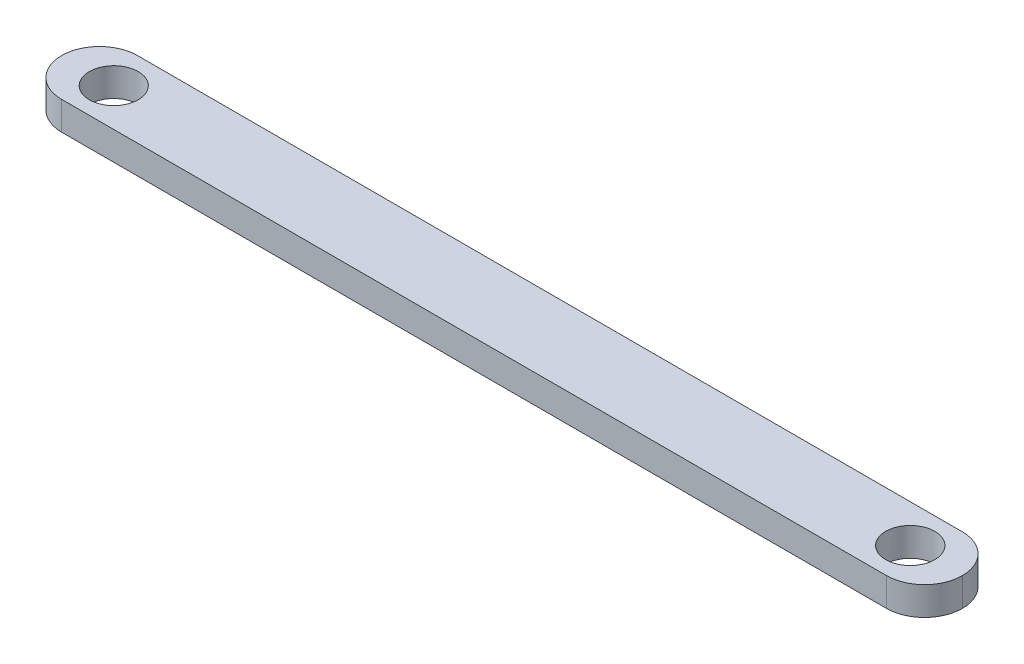
from build123d import *

# Parameters (mm, degrees)
SKETCH1_W           = 95
SKETCH1_H           = 8
SKETCH1_R           = 2.58
SKETCH1_R_2         = 2.59
BOSS_EXTRUDE1_DEPTH = 3
REDONDEO2_R         = 4


with BuildPart() as part:
    # Sketch1 → Boss-Extrude1 (new body)
    with BuildSketch(Plane(origin=(0, 0, 0), x_dir=(1, 0, 0), z_dir=(0, 1, 0))):
        with Locations((-0.1, 1.5)):
            Rectangle(SKETCH1_W, SKETCH1_H)
        with Locations(Location((-42.1, 1.5, 0), (0, 0, 270))):
            Circle(SKETCH1_R, mode=Mode.SUBTRACT)
        with Locations(Location((41.9, 1.5, 0), (0, 0, 270))):
            Circle(SKETCH1_R_2, mode=Mode.SUBTRACT)
    extrude(amount=BOSS_EXTRUDE1_DEPTH)

    # Redondeo2
    redondeo2_edges = [part.edges().sort_by_distance(p)[0] for p in [
        (47.4, 1.5, -5.5),
        (47.4, 1.5, 2.5),
        (-47.6, 1.5, -5.5),
        (-47.6, 1.5, 2.5),
    ]]
    fillet(redondeo2_edges, radius=REDONDEO2_R - 0.0001)  # a hair under: the kernel refuses the full size


solid = part.part
